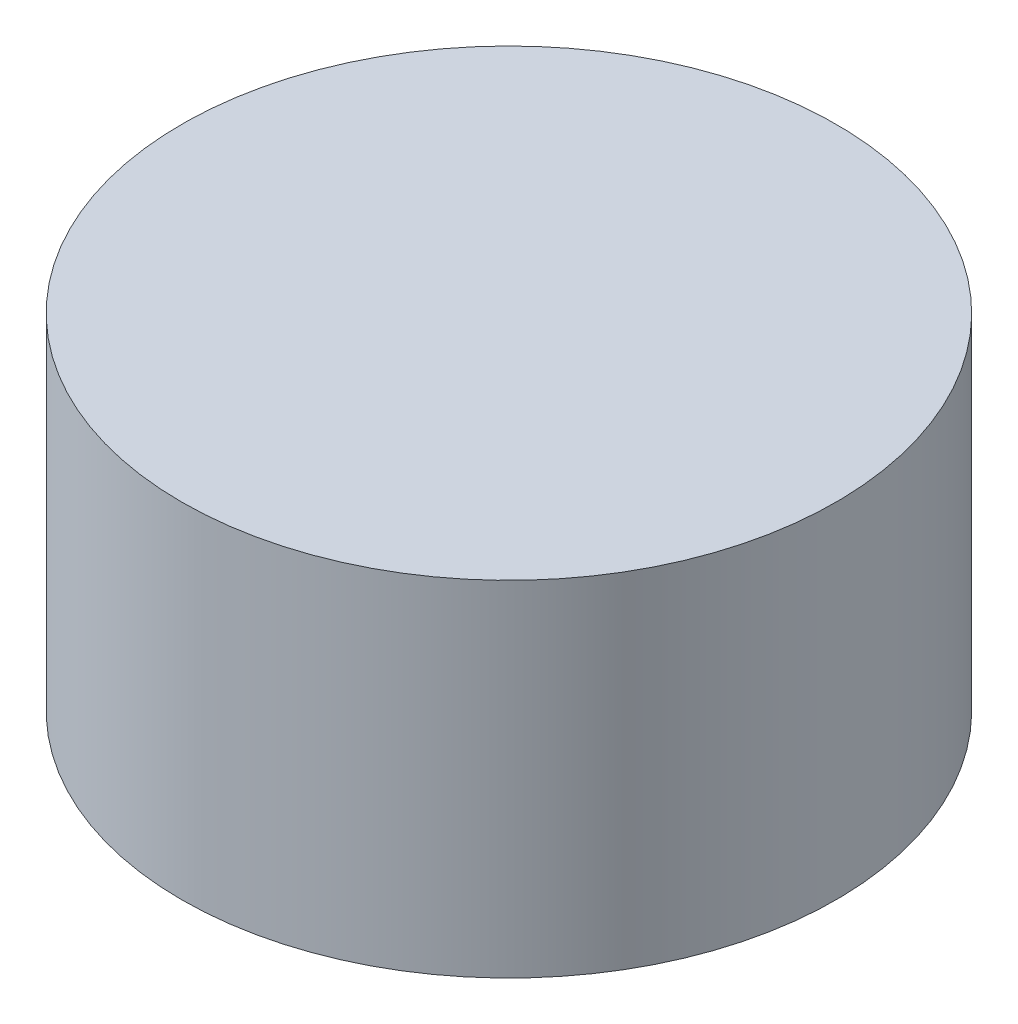
from build123d import *

# Parameters (mm, degrees)
BOSS_EXTRUDE1_OUTLINE_R = 120.65
BOSS_EXTRUDE1_DEPTH     = 127


# Read off the part's stored shape, not the designer's step: Boss-Extrude1
with BuildPart() as part:
    # Boss-Extrude1 outline → Boss-Extrude1 (new body)
    with BuildSketch(Plane(origin=(0, 0, 0), x_dir=(1, 0, 0), z_dir=(0, 1, 0))):
        Circle(BOSS_EXTRUDE1_OUTLINE_R)
    extrude(amount=BOSS_EXTRUDE1_DEPTH)


solid = part.part
